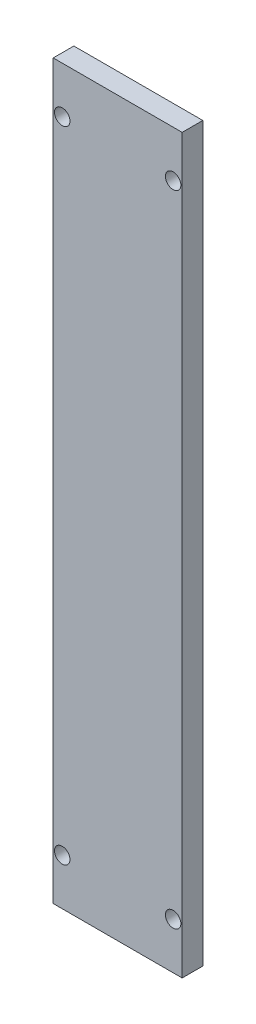
from build123d import *

# Parameters (mm, degrees)
ESQUISSE1_W             = 50
ESQUISSE1_H             = 284
BOSS_EXTRU_1_DEPTH      = 8
ESQUISSE2_R             = 3
ENL_V_MAT_EXTRU_1_DEPTH = 289.478768716


with BuildPart() as part:
    # Esquisse1 → Boss.-Extru.1 (new body)
    with BuildSketch(Plane.XY):
        with Locations((25, 142)):
            Rectangle(ESQUISSE1_W, ESQUISSE1_H)
    extrude(amount=BOSS_EXTRU_1_DEPTH)

    # Esquisse2 → Enlèv. mat.-Extru.1 (cut, through all)
    with BuildSketch(Plane.XY.offset(8)):
        with Locations((3.5, 18)):
            Circle(ESQUISSE2_R)
        with Locations((46.5, 18)):
            Circle(ESQUISSE2_R)
        with Locations((46.5, 266)):
            Circle(ESQUISSE2_R)
        with Locations((3.5, 266)):
            Circle(ESQUISSE2_R)
    extrude(amount=-ENL_V_MAT_EXTRU_1_DEPTH, mode=Mode.SUBTRACT)


solid = part.part
